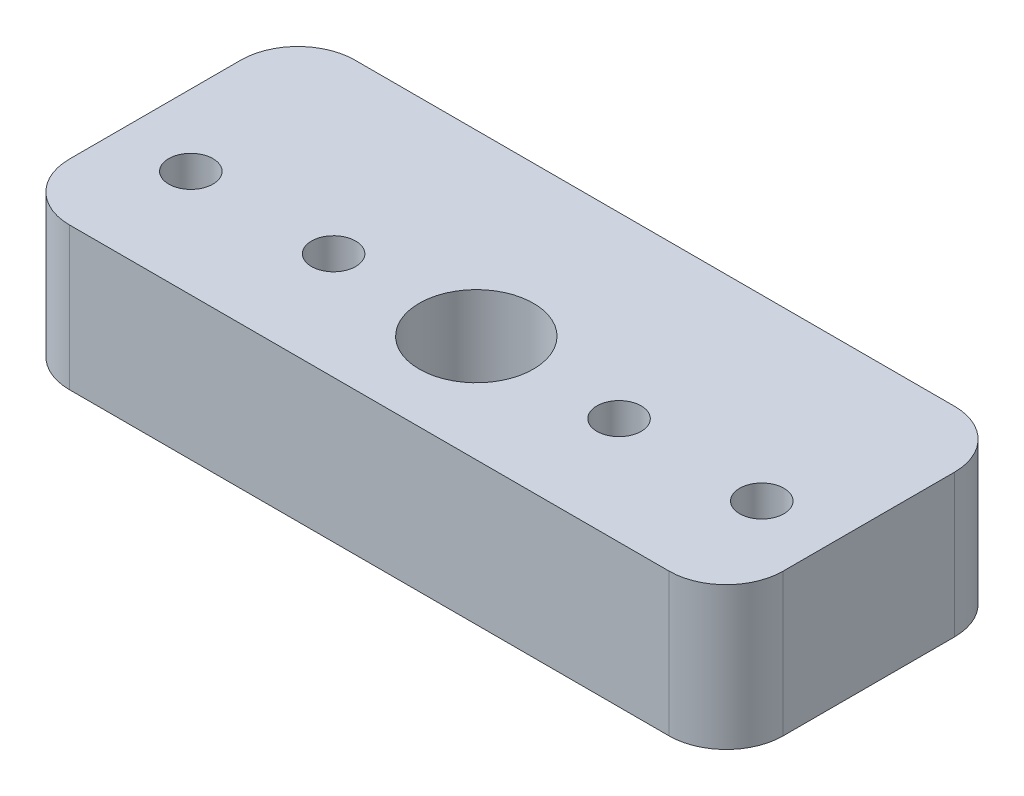
from build123d import *

# Parameters (mm, degrees)
SKETCH1_R           = 4
SKETCH1_R_2         = 1.55
BOSS_EXTRUDE1_DEPTH = 10


with BuildPart() as part:
    # Sketch1 → Boss-Extrude1 (new body)
    with BuildSketch(Plane(origin=(0, 0, 0), x_dir=(1, 0, 0), z_dir=(0, 1, 0))):
        with BuildLine():
            Line((-21, 10), (21, 10))
            ThreePointArc((21, 10), (23.828427125, 8.828427125), (25, 6))
            Line((25, 6), (25, -6))
            ThreePointArc((25, -6), (23.828427125, -8.828427125), (21, -10))
            Line((21, -10), (-21, -10))
            ThreePointArc((-21, -10), (-23.828427125, -8.828427125), (-25, -6))
            Line((-25, -6), (-25, 6))
            ThreePointArc((-25, 6), (-23.828427125, 8.828427125), (-21, 10))
        make_face()
        with Locations((0, -2.5)):
            Circle(SKETCH1_R, mode=Mode.SUBTRACT)
        with Locations((10, -2.5)):
            Circle(SKETCH1_R_2, mode=Mode.SUBTRACT)
        with Locations((20, -2.5)):
            Circle(SKETCH1_R_2, mode=Mode.SUBTRACT)
        with Locations((-20, -2.5)):
            Circle(SKETCH1_R_2, mode=Mode.SUBTRACT)
        with Locations((-10, -2.5)):
            Circle(SKETCH1_R_2, mode=Mode.SUBTRACT)
    extrude(amount=BOSS_EXTRUDE1_DEPTH)


solid = part.part
